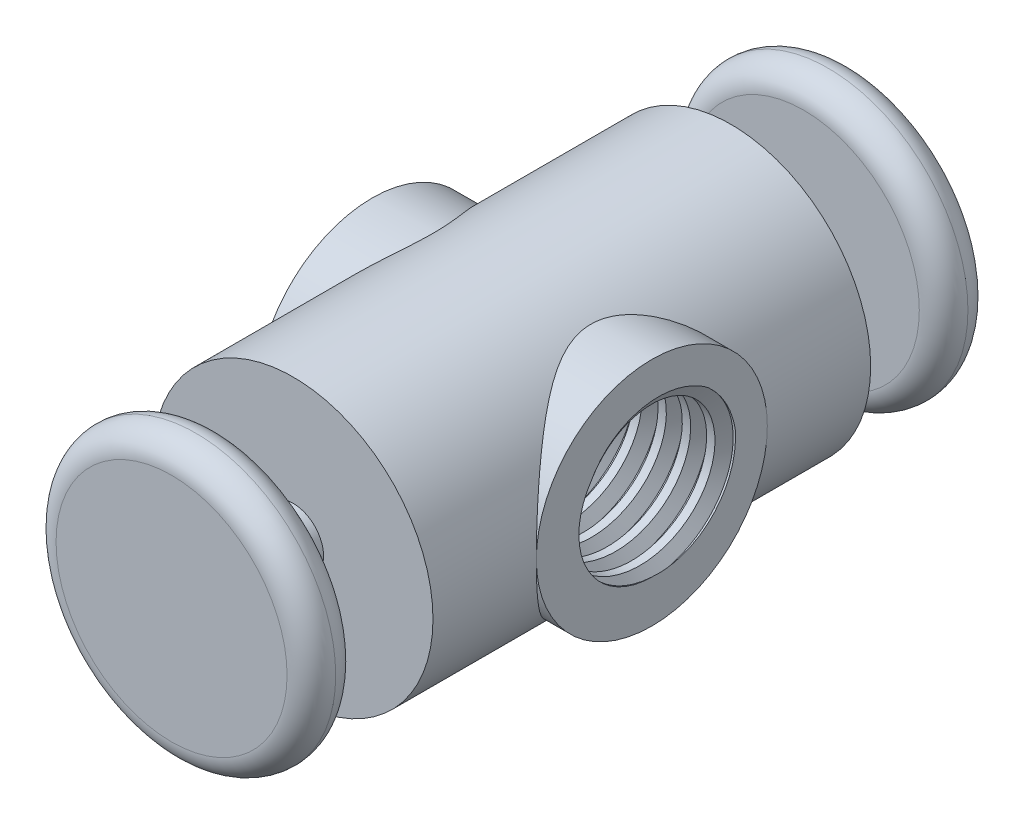
from build123d import *

# Parameters (mm, degrees)
SKETCH1_R               = 11.5
BOSS_EXTRUDE1_DEPTH     = 18
SKETCH2_R               = 2.5
BOSS_EXTRUDE2_DEPTH     = 6
SKETCH3_R               = 11.5
BOSS_EXTRUDE3_DEPTH     = 4
FILLET1_R               = 2
CUT_EXTRUDE2_DEPTH      = 33.380549753
CUT_EXTRUDE2_DEPTH_BACK = 33.380549753
SKETCH5_R               = 6
SKETCH6_R               = 9.5
SKETCH6_R_2             = 6
BOSS_EXTRUDE4_DEPTH     = 23
THREAD1_PITCH           = 2


with BuildPart() as part:
    # Sketch1 → Boss-Extrude1 (new body)
    with BuildSketch(Plane.XY):
        Circle(SKETCH1_R)
    extrude(amount=BOSS_EXTRUDE1_DEPTH)

    # Sketch2 → Boss-Extrude2 (add)
    with BuildSketch(Plane.XY.offset(18)):
        Circle(SKETCH2_R)
    extrude(amount=BOSS_EXTRUDE2_DEPTH)

    # Sketch3 → Boss-Extrude3 (add)
    with BuildSketch(Plane.XY.offset(24)):
        Circle(SKETCH3_R)
    extrude(amount=BOSS_EXTRUDE3_DEPTH)

    # Fillet1
    fillet1_edges = [part.edges().sort_by_distance(p)[0] for p in [
        (-11.5, 0, 24),
        (-11.5, 0, 28),
    ]]
    fillet(fillet1_edges, radius=FILLET1_R - 0.0001)  # a hair under: the kernel refuses the full size

    # Mirror1: part across plane


with BuildPart() as part_1:
    add(part.part)
    add(part.part.mirror(Plane.XY))

    # Sketch5 → Cut-Extrude2 (cut, two sides: drawn at the far end of the back side and taken through both)
    with BuildSketch(Plane(origin=(0, 0, 0), x_dir=(0, 0, -1), z_dir=(1, 0, 0)).offset(-CUT_EXTRUDE2_DEPTH_BACK)):
        Circle(SKETCH5_R)
    extrude(amount=CUT_EXTRUDE2_DEPTH + CUT_EXTRUDE2_DEPTH_BACK, mode=Mode.SUBTRACT)

    # Sketch6 → Boss-Extrude4 (add)
    with BuildSketch(Plane(origin=(11.5, 0, 0), x_dir=(0, 0, -1), z_dir=(1, 0, 0))):
        Circle(SKETCH6_R)
        Circle(SKETCH6_R_2, mode=Mode.SUBTRACT)
    extrude(amount=-BOSS_EXTRUDE4_DEPTH)

    # Thread1: the profile of Thread Profile1 profile screwed along a right-hand helix of 12.25 turns, 10 arcs to a turn; built about Z, then put on its axis
    thread1_z = Axis((0, 0, 0), (0, 0, 1))
    thread1_corners = [(5.9997, 0, -0.000173205), (6.947215281, 0, 0.546874998), (6.947215281, 0, 0.765624998), (5.9997, 0, 1.3126732)]
    with BuildLine(mode=Mode.PRIVATE) as thread1_profile:
        Line(thread1_corners[0], thread1_corners[1])
        Line(thread1_corners[1], thread1_corners[2])
        Line(thread1_corners[2], thread1_corners[3])
        Line(thread1_corners[3], thread1_corners[0])
    thread1_cap = Face(thread1_profile.wire())
    thread1_turn_angles = [0, 18, 36, 54, 72, 90, 108, 126, 144, 162, 180, 198, 216, 234, 252, 270, 288, 306, 324, 342, 360]
    thread1_turn_weights = [1, 0.9510565162951535, 1, 0.9510565162951535, 1, 0.9510565162951535, 1, 0.9510565162951535, 1, 0.9510565162951535, 1, 0.9510565162951535, 1, 0.9510565162951535, 1, 0.9510565162951535, 1, 0.9510565162951535, 1, 0.9510565162951535, 1]
    thread1_turn_rails = [Edge.make_bspline([Vector(p[0], p[1], 0).rotate(thread1_z, thread1_turn_angles[k]) / thread1_turn_weights[k] + Vector(0, 0, p[2] + THREAD1_PITCH * thread1_turn_angles[k] / 360) for k in range(21)], [0, 0, 0, 1, 1, 2, 2, 3, 3, 4, 4, 5, 5, 6, 6, 7, 7, 8, 8, 9, 9, 10, 10, 10], 2, thread1_turn_weights) for p in thread1_corners]
    thread1_turn_sides = [Face.make_surface_from_curves(thread1_turn_rails[p[0]], thread1_turn_rails[p[1]]) for p in [(0, 1), (1, 2), (2, 3), (3, 0)]]
    thread1_last_angles = [4320, 4338, 4356, 4374, 4392, 4401, 4410]
    thread1_last_weights = [1, 0.9510565162951535, 1, 0.9510565162951535, 1, 0.9876883405951378, 1]
    thread1_last_rails = [Edge.make_bspline([Vector(p[0], p[1], 0).rotate(thread1_z, thread1_last_angles[k]) / thread1_last_weights[k] + Vector(0, 0, p[2] + THREAD1_PITCH * thread1_last_angles[k] / 360) for k in range(7)], [0, 0, 0, 1, 1, 2, 2, 3, 3, 3], 2, thread1_last_weights) for p in thread1_corners]
    thread1_last_sides = [Face.make_surface_from_curves(thread1_last_rails[p[0]], thread1_last_rails[p[1]]) for p in [(0, 1), (1, 2), (2, 3), (3, 0)]]
    thread1 = Plane(origin=(13, 0, 0), x_dir=(0, 0, 1), z_dir=(-1, 0, 0)) * Solid(Shell([*[p.moved(Location((0, 0, THREAD1_PITCH * i))) for i in range(12) for p in thread1_turn_sides], *thread1_last_sides, thread1_cap, thread1_cap.rotate(thread1_z, 4410).moved(Location((0, 0, THREAD1_PITCH * 4410 / 360)))]))
    add(thread1, mode=Mode.SUBTRACT)


solid = part_1.part
